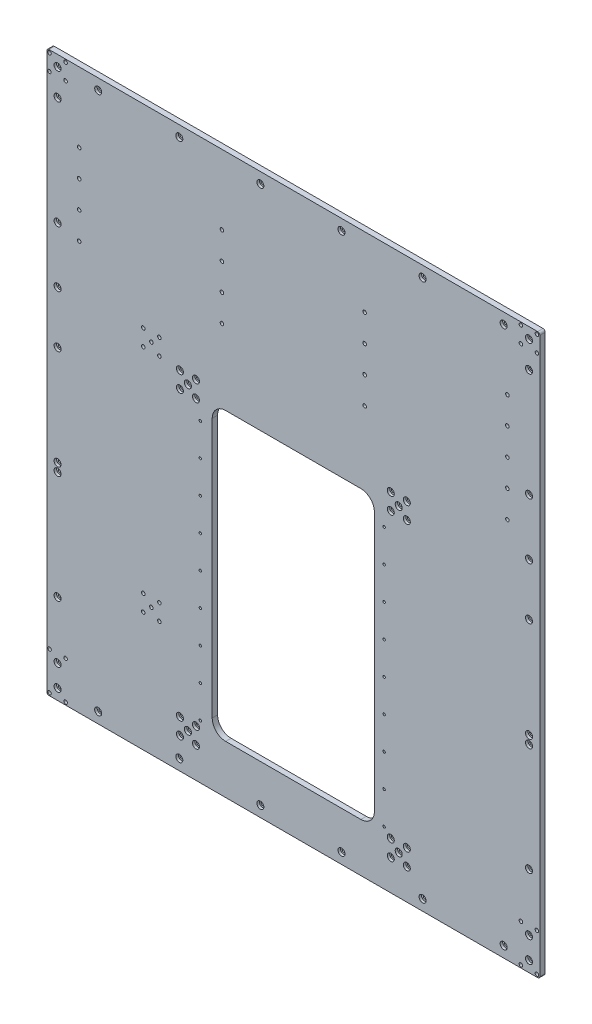
from build123d import *

# Parameters (mm, degrees)
BOSS_EXTRU_1_DEPTH                           = 10
ENL_V_MAT_EXTRU_1_DEPTH                      = 690.813199352
D_GAGEMENT_M63_D                             = 6.6
R_P_TITION_LIN_AIRE5_COUNT                   = 2
R_P_TITION_LIN_AIRE5_PITCH                   = 390
R_P_TITION_LIN_AIRE5_COUNT_DIR2              = 2
R_P_TITION_LIN_AIRE5_PITCH_DIR2              = 555
CHAMBRAGE_POUR_VIS_T_TE_RONDE_BOMB_2_COUNT   = 2
CHAMBRAGE_POUR_VIS_T_TE_RONDE_BOMB_2_PITCH   = 21.009003944
CHAMBRAGE_POUR_VIS_T_TE_RONDE_BOMB_3_COUNT   = 2
CHAMBRAGE_POUR_VIS_T_TE_RONDE_BOMB_3_PITCH   = 21.131226097
CHAMBRAGE_POUR_VIS_T_TE_RONDE_BOMB_4_COUNT   = 2
CHAMBRAGE_POUR_VIS_T_TE_RONDE_BOMB_4_PITCH   = 21.298652181
CHAMBRAGE_POUR_VIS_T_TE_RONDE_BOMB_5_COUNT   = 2
CHAMBRAGE_POUR_VIS_T_TE_RONDE_BOMB_5_PITCH   = 21.177396325
R_P_TITION_LIN_AIRE6_COUNT                   = 2
R_P_TITION_LIN_AIRE6_PITCH                   = 390
R_P_TITION_LIN_AIRE6_COUNT_DIR2              = 2
R_P_TITION_LIN_AIRE6_PITCH_DIR2              = 555
D_GAGEMENT_M64_D                             = 6.6
CHAMBRAGE_POUR_VIS_T_TE_RONDE_BOMB_6_A_COUNT = 2
CHAMBRAGE_POUR_VIS_T_TE_RONDE_BOMB_6_A_PITCH = 29.81471185
CHAMBRAGE_POUR_VIS_T_TE_RONDE_BOMB_7_COUNT   = 2
CHAMBRAGE_POUR_VIS_T_TE_RONDE_BOMB_7_PITCH   = 21.093697317
CHAMBRAGE_POUR_VIS_T_TE_RONDE_BOMB_8_COUNT   = 2
CHAMBRAGE_POUR_VIS_T_TE_RONDE_BOMB_8_PITCH   = 42.330145982
CHAMBRAGE_POUR_VIS_T_TE_RONDE_BOMB_9_COUNT   = 2
CHAMBRAGE_POUR_VIS_T_TE_RONDE_BOMB_9_PITCH   = 30.048697412
R_P_TITION_LIN_AIRE7_COUNT                   = 2
R_P_TITION_LIN_AIRE7_PITCH                   = 425
D_GAGEMENT_M41_D                             = 4.5
R_P_TITION_LIN_AIRE8_COUNT                   = 9
R_P_TITION_LIN_AIRE8_PITCH                   = 60
R_P_TITION_LIN_AIRE8_COUNT_DIR2              = 2
R_P_TITION_LIN_AIRE8_PITCH_DIR2              = 340
D_GAGEMENT_M65_D                             = 6.6
R_P_TITION_LIN_AIRE9_COUNT                   = 2
R_P_TITION_LIN_AIRE9_PITCH                   = 872
R_P_TITION_LIN_AIRE10_COUNT                  = 6
R_P_TITION_LIN_AIRE10_PITCH                  = 150
R_P_TITION_LIN_AIRE11_COUNT                  = 5
R_P_TITION_LIN_AIRE11_PITCH                  = 200
R_P_TITION_LIN_AIRE11_COUNT_DIR2             = 2
R_P_TITION_LIN_AIRE11_PITCH_DIR2             = 872
CHAMBRAGE_POUR_VIS_T_TE_RONDE_BOMB_14_COUNT  = 2
CHAMBRAGE_POUR_VIS_T_TE_RONDE_BOMB_14_PITCH  = 40
R_P_TITION_LIN_AIRE13_COUNT                  = 2
R_P_TITION_LIN_AIRE13_PITCH                  = 872
R_P_TITION_LIN_AIRE14_COUNT                  = 6
R_P_TITION_LIN_AIRE14_PITCH                  = 150
D_GAGEMENT_M66_D                             = 6.6
ESQUISSE41_R                                 = 1.5
ENL_V_MAT_EXTRU_2_DEPTH                      = 690.813199352
CHAMBRAGE_POUR_VIS_T_TE_RONDE_BOMB_17_COUNT  = 2
CHAMBRAGE_POUR_VIS_T_TE_RONDE_BOMB_17_PITCH  = 281
CHAMBRAGE_POUR_VIS_T_TE_RONDE_BOMB_18_COUNT  = 2
CHAMBRAGE_POUR_VIS_T_TE_RONDE_BOMB_18_PITCH  = 916.15773751
CHAMBRAGE_POUR_VIS_T_TE_RONDE_BOMB_19_COUNT  = 2
CHAMBRAGE_POUR_VIS_T_TE_RONDE_BOMB_19_PITCH  = 872
D_GAGEMENT_M67_D                             = 6.6
R_P_TITION_LIN_AIRE15_COUNT                  = 4
R_P_TITION_LIN_AIRE15_PITCH                  = 264
R_P_TITION_LIN_AIRE15_COUNT_DIR2             = 5
R_P_TITION_LIN_AIRE15_PITCH_DIR2             = 50


with BuildPart() as part:
    # Esquisse1 → Boss.-Extru.1 (new body)
    with BuildSketch(Plane.XY):
        with BuildLine():
            Line((-452, -517.5), (452, -517.5))
            ThreePointArc((452, -517.5), (454.828427125, -516.328427125), (456, -513.5))
            Line((456, -513.5), (456, 513.5))
            ThreePointArc((456, 513.5), (454.828427125, 516.328427125), (452, 517.5))
            Line((452, 517.5), (-452, 517.5))
            ThreePointArc((-452, 517.5), (-454.828427125, 516.328427125), (-456, 513.5))
            Line((-456, 513.5), (-456, -513.5))
            ThreePointArc((-456, -513.5), (-454.828427125, -516.328427125), (-452, -517.5))
        make_face()
    extrude(amount=BOSS_EXTRU_1_DEPTH)

    # Esquisse2 → Enlèv. mat.-Extru.1 (cut, through all)
    with BuildSketch(Plane.XY.offset(10)):
        with BuildLine():
            Line((-125, -427.5), (125, -427.5))
            ThreePointArc((125, -427.5), (142.67766953, -420.17766953), (150, -402.5))
            Line((150, -402.5), (150, 77.5))
            ThreePointArc((150, 77.5), (142.67766953, 95.17766953), (125, 102.5))
            Line((125, 102.5), (-125, 102.5))
            ThreePointArc((-125, 102.5), (-142.67766953, 95.17766953), (-150, 77.5))
            Line((-150, 77.5), (-150, -402.5))
            ThreePointArc((-150, -402.5), (-142.67766953, -420.17766953), (-125, -427.5))
        make_face()
    extrude(amount=-ENL_V_MAT_EXTRU_1_DEPTH, mode=Mode.SUBTRACT)

    # Dégagement M63 (through all)
    with Locations(Plane(origin=(0, 0, 0), x_dir=(-1, 0, 0), z_dir=(0, 0, -1))):
        with Locations((-195, 109.5), (-209.949318215, 94.5), (-209.949318215, 124.670710913), (-180.290198957, 124.670710913), (-180.290198957, 94.5)):
            d_gagement_m63 = Hole(D_GAGEMENT_M63_D / 2)

    # Répétition linéaire5: D_gagement M63 2 × 2
    with Locations(*[(-i * R_P_TITION_LIN_AIRE5_PITCH, -j * R_P_TITION_LIN_AIRE5_PITCH_DIR2, 0) for i in range(R_P_TITION_LIN_AIRE5_COUNT) for j in range(R_P_TITION_LIN_AIRE5_COUNT_DIR2) if (i, j) != (0, 0)]):
        add(d_gagement_m63, mode=Mode.SUBTRACT)

    # Esquisse17 → Chambrage pour vis _ t_te ronde bomb_e M (revolve, cut)
    with BuildSketch(Plane(origin=(-195, 109.5, 10), x_dir=(0, -1, 0), z_dir=(1, 0, 0))):
        Polygon((0, 0), (0, 10), (3.3, 10), (3.3, 4.625), (3.325, 4.6), (6.5, 4.6), (6.5, 0), align=None)
    chambrage_pour_vis_t_te_ronde_bomb_e_m = revolve(axis=Axis((-195, 109.5, 16.35), (0, 0, -1)), mode=Mode.SUBTRACT)

    # Chambrage pour vis _ t_te ronde bomb 2: Chambrage pour vis _ t_te ronde bomb_e M ×2
    with Locations(*[Vector(-0.7001665134724497, -0.7139795889322286, 0) * (i * CHAMBRAGE_POUR_VIS_T_TE_RONDE_BOMB_2_PITCH) for i in range(1, CHAMBRAGE_POUR_VIS_T_TE_RONDE_BOMB_2_COUNT)]):
        add(chambrage_pour_vis_t_te_ronde_bomb_e_m, mode=Mode.SUBTRACT)

    # Chambrage pour vis _ t_te ronde bomb 3: Chambrage pour vis _ t_te ronde bomb_e M ×2
    with Locations(*[Vector(-0.6961167788321365, 0.7179285690292387, 0) * (i * CHAMBRAGE_POUR_VIS_T_TE_RONDE_BOMB_3_PITCH) for i in range(1, CHAMBRAGE_POUR_VIS_T_TE_RONDE_BOMB_3_COUNT)]):
        add(chambrage_pour_vis_t_te_ronde_bomb_e_m, mode=Mode.SUBTRACT)

    # Chambrage pour vis _ t_te ronde bomb 4: Chambrage pour vis _ t_te ronde bomb_e M ×2
    with Locations(*[Vector(0.7018903397460314, 0.7122850208808275, 0) * (i * CHAMBRAGE_POUR_VIS_T_TE_RONDE_BOMB_4_PITCH) for i in range(1, CHAMBRAGE_POUR_VIS_T_TE_RONDE_BOMB_4_COUNT)]):
        add(chambrage_pour_vis_t_te_ronde_bomb_e_m, mode=Mode.SUBTRACT)

    # Chambrage pour vis _ t_te ronde bomb 5: Chambrage pour vis _ t_te ronde bomb_e M ×2
    with Locations(*[Vector(0.7059091677743664, -0.708302369650209, 0) * (i * CHAMBRAGE_POUR_VIS_T_TE_RONDE_BOMB_5_PITCH) for i in range(1, CHAMBRAGE_POUR_VIS_T_TE_RONDE_BOMB_5_COUNT)]):
        add(chambrage_pour_vis_t_te_ronde_bomb_e_m, mode=Mode.SUBTRACT)

    # Répétition linéaire6: Chambrage pour vis _ t_te ronde bomb_e M 2 × 2
    with Locations(*[(i * R_P_TITION_LIN_AIRE6_PITCH, -j * R_P_TITION_LIN_AIRE6_PITCH_DIR2, 0) for i in range(R_P_TITION_LIN_AIRE6_COUNT) for j in range(R_P_TITION_LIN_AIRE6_COUNT_DIR2) if (i, j) != (0, 0)]):
        add(chambrage_pour_vis_t_te_ronde_bomb_e_m, mode=Mode.SUBTRACT)

    # Répétition linéaire6 copy 1 sketch → Répétition linéaire6 copy 1 (revolve, cut)
    with BuildSketch(Plane(origin=(-209.709801043, -460.5, 10), x_dir=(0, -1, 0), z_dir=(1, 0, 0))):
        Polygon((0, 0), (0, 10), (3.3, 10), (3.3, 4.625), (3.325, 4.6), (6.5, 4.6), (6.5, 0), align=None)
    revolve(axis=Axis((-209.709801043, -460.5, 16.35), (0, 0, -1)), mode=Mode.SUBTRACT)

    # Répétition linéaire6 copy 2 sketch → Répétition linéaire6 copy 2 (revolve, cut)
    with BuildSketch(Plane(origin=(180.290198957, 94.5, 10), x_dir=(0, -1, 0), z_dir=(1, 0, 0))):
        Polygon((0, 0), (0, 10), (3.3, 10), (3.3, 4.625), (3.325, 4.6), (6.5, 4.6), (6.5, 0), align=None)
    revolve(axis=Axis((180.290198957, 94.5, 16.35), (0, 0, -1)), mode=Mode.SUBTRACT)

    # Répétition linéaire6 copy 3 sketch → Répétition linéaire6 copy 3 (revolve, cut)
    with BuildSketch(Plane(origin=(180.290198957, -460.5, 10), x_dir=(0, -1, 0), z_dir=(1, 0, 0))):
        Polygon((0, 0), (0, 10), (3.3, 10), (3.3, 4.625), (3.325, 4.6), (6.5, 4.6), (6.5, 0), align=None)
    revolve(axis=Axis((180.290198957, -460.5, 16.35), (0, 0, -1)), mode=Mode.SUBTRACT)

    # Répétition linéaire6 copy 4 sketch → Répétition linéaire6 copy 4 (revolve, cut)
    with BuildSketch(Plane(origin=(-209.709801043, -430.329289087, 10), x_dir=(0, -1, 0), z_dir=(1, 0, 0))):
        Polygon((0, 0), (0, 10), (3.3, 10), (3.3, 4.625), (3.325, 4.6), (6.5, 4.6), (6.5, 0), align=None)
    revolve(axis=Axis((-209.709801043, -430.329289087, 16.35), (0, 0, -1)), mode=Mode.SUBTRACT)

    # Répétition linéaire6 copy 5 sketch → Répétition linéaire6 copy 5 (revolve, cut)
    with BuildSketch(Plane(origin=(180.290198957, 124.670710913, 10), x_dir=(0, -1, 0), z_dir=(1, 0, 0))):
        Polygon((0, 0), (0, 10), (3.3, 10), (3.3, 4.625), (3.325, 4.6), (6.5, 4.6), (6.5, 0), align=None)
    revolve(axis=Axis((180.290198957, 124.670710913, 16.35), (0, 0, -1)), mode=Mode.SUBTRACT)

    # Répétition linéaire6 copy 6 sketch → Répétition linéaire6 copy 6 (revolve, cut)
    with BuildSketch(Plane(origin=(180.290198957, -430.329289087, 10), x_dir=(0, -1, 0), z_dir=(1, 0, 0))):
        Polygon((0, 0), (0, 10), (3.3, 10), (3.3, 4.625), (3.325, 4.6), (6.5, 4.6), (6.5, 0), align=None)
    revolve(axis=Axis((180.290198957, -430.329289087, 16.35), (0, 0, -1)), mode=Mode.SUBTRACT)

    # Répétition linéaire6 copy 7 sketch → Répétition linéaire6 copy 7 (revolve, cut)
    with BuildSketch(Plane(origin=(-180.050681785, -430.329289087, 10), x_dir=(0, -1, 0), z_dir=(1, 0, 0))):
        Polygon((0, 0), (0, 10), (3.3, 10), (3.3, 4.625), (3.325, 4.6), (6.5, 4.6), (6.5, 0), align=None)
    revolve(axis=Axis((-180.050681785, -430.329289087, 16.35), (0, 0, -1)), mode=Mode.SUBTRACT)

    # Répétition linéaire6 copy 8 sketch → Répétition linéaire6 copy 8 (revolve, cut)
    with BuildSketch(Plane(origin=(209.949318215, 124.670710913, 10), x_dir=(0, -1, 0), z_dir=(1, 0, 0))):
        Polygon((0, 0), (0, 10), (3.3, 10), (3.3, 4.625), (3.325, 4.6), (6.5, 4.6), (6.5, 0), align=None)
    revolve(axis=Axis((209.949318215, 124.670710913, 16.35), (0, 0, -1)), mode=Mode.SUBTRACT)

    # Répétition linéaire6 copy 9 sketch → Répétition linéaire6 copy 9 (revolve, cut)
    with BuildSketch(Plane(origin=(209.949318215, -430.329289087, 10), x_dir=(0, -1, 0), z_dir=(1, 0, 0))):
        Polygon((0, 0), (0, 10), (3.3, 10), (3.3, 4.625), (3.325, 4.6), (6.5, 4.6), (6.5, 0), align=None)
    revolve(axis=Axis((209.949318215, -430.329289087, 16.35), (0, 0, -1)), mode=Mode.SUBTRACT)

    # Répétition linéaire6 copy 10 sketch → Répétition linéaire6 copy 10 (revolve, cut)
    with BuildSketch(Plane(origin=(-180.050681785, -460.5, 10), x_dir=(0, -1, 0), z_dir=(1, 0, 0))):
        Polygon((0, 0), (0, 10), (3.3, 10), (3.3, 4.625), (3.325, 4.6), (6.5, 4.6), (6.5, 0), align=None)
    revolve(axis=Axis((-180.050681785, -460.5, 16.35), (0, 0, -1)), mode=Mode.SUBTRACT)

    # Répétition linéaire6 copy 11 sketch → Répétition linéaire6 copy 11 (revolve, cut)
    with BuildSketch(Plane(origin=(209.949318215, 94.5, 10), x_dir=(0, -1, 0), z_dir=(1, 0, 0))):
        Polygon((0, 0), (0, 10), (3.3, 10), (3.3, 4.625), (3.325, 4.6), (6.5, 4.6), (6.5, 0), align=None)
    revolve(axis=Axis((209.949318215, 94.5, 16.35), (0, 0, -1)), mode=Mode.SUBTRACT)

    # Répétition linéaire6 copy 12 sketch → Répétition linéaire6 copy 12 (revolve, cut)
    with BuildSketch(Plane(origin=(209.949318215, -460.5, 10), x_dir=(0, -1, 0), z_dir=(1, 0, 0))):
        Polygon((0, 0), (0, 10), (3.3, 10), (3.3, 4.625), (3.325, 4.6), (6.5, 4.6), (6.5, 0), align=None)
    revolve(axis=Axis((209.949318215, -460.5, 16.35), (0, 0, -1)), mode=Mode.SUBTRACT)

    # Dégagement M64 (through all)
    with Locations(Plane.XY.offset(10)):
        with Locations((-277.5, 158.515604526), (-247.68528815, 158.515604526), (-247.68528815, 128.466907114), (-277.5, 128.466907114), (-262.5, 143.5)):
            Hole(D_GAGEMENT_M64_D / 2)

    # Esquisse21 → Chambrage pour vis _ t_te ronde bomb 6 (revolve, cut)
    with BuildSketch(Plane(origin=(-247.68528815, 158.515604526, 0), x_dir=(0, 1, 0), z_dir=(1, 0, 0))):
        Polygon((0, 0), (0, 10), (3.3, 10), (3.3, 4.625), (3.325, 4.6), (6.5, 4.6), (6.5, 0), align=None)
    chambrage_pour_vis_t_te_ronde_bomb_6 = revolve(axis=Axis((-247.68528815, 158.515604526, -6.35), (0, 0, 1)), mode=Mode.SUBTRACT)

    # Chambrage pour vis _ t_te ronde bomb 6 a: Chambrage pour vis _ t_te ronde bomb 6 ×2
    with Locations(*[(-i * CHAMBRAGE_POUR_VIS_T_TE_RONDE_BOMB_6_A_PITCH, 0, 0) for i in range(1, CHAMBRAGE_POUR_VIS_T_TE_RONDE_BOMB_6_A_COUNT)]):
        add(chambrage_pour_vis_t_te_ronde_bomb_6, mode=Mode.SUBTRACT)

    # Chambrage pour vis _ t_te ronde bomb 7: Chambrage pour vis _ t_te ronde bomb 6 ×2
    with Locations(*[Vector(-0.7023288344180294, -0.7118526591542749, 0) * (i * CHAMBRAGE_POUR_VIS_T_TE_RONDE_BOMB_7_PITCH) for i in range(1, CHAMBRAGE_POUR_VIS_T_TE_RONDE_BOMB_7_COUNT)]):
        add(chambrage_pour_vis_t_te_ronde_bomb_6, mode=Mode.SUBTRACT)

    # Chambrage pour vis _ t_te ronde bomb 8: Chambrage pour vis _ t_te ronde bomb 6 ×2
    with Locations(*[Vector(-0.7043375627044492, -0.7098651968955486, 0) * (i * CHAMBRAGE_POUR_VIS_T_TE_RONDE_BOMB_8_PITCH) for i in range(1, CHAMBRAGE_POUR_VIS_T_TE_RONDE_BOMB_8_COUNT)]):
        add(chambrage_pour_vis_t_te_ronde_bomb_6, mode=Mode.SUBTRACT)

    # Chambrage pour vis _ t_te ronde bomb 9: Chambrage pour vis _ t_te ronde bomb 6 ×2
    with Locations(*[(0, -i * CHAMBRAGE_POUR_VIS_T_TE_RONDE_BOMB_9_PITCH, 0) for i in range(1, CHAMBRAGE_POUR_VIS_T_TE_RONDE_BOMB_9_COUNT)]):
        add(chambrage_pour_vis_t_te_ronde_bomb_6, mode=Mode.SUBTRACT)

    # Répétition linéaire7: Chambrage pour vis _ t_te ronde bomb 6 ×2
    with Locations(*[(0, -i * R_P_TITION_LIN_AIRE7_PITCH, 0) for i in range(1, R_P_TITION_LIN_AIRE7_COUNT)]):
        add(chambrage_pour_vis_t_te_ronde_bomb_6, mode=Mode.SUBTRACT)

    # Répétition linéaire7 copy 1 sketch → Répétition linéaire7 copy 1 (revolve, cut)
    with BuildSketch(Plane(origin=(-277.5, -266.484395474, 0), x_dir=(0, 1, 0), z_dir=(1, 0, 0))):
        Polygon((0, 0), (0, 10), (3.3, 10), (3.3, 4.625), (3.325, 4.6), (6.5, 4.6), (6.5, 0), align=None)
    revolve(axis=Axis((-277.5, -266.484395474, -6.35), (0, 0, 1)), mode=Mode.SUBTRACT)

    # Répétition linéaire7 copy 2 sketch → Répétition linéaire7 copy 2 (revolve, cut)
    with BuildSketch(Plane(origin=(-262.5, -281.5, 0), x_dir=(0, 1, 0), z_dir=(1, 0, 0))):
        Polygon((0, 0), (0, 10), (3.3, 10), (3.3, 4.625), (3.325, 4.6), (6.5, 4.6), (6.5, 0), align=None)
    revolve(axis=Axis((-262.5, -281.5, -6.35), (0, 0, 1)), mode=Mode.SUBTRACT)

    # Répétition linéaire7 copy 3 sketch → Répétition linéaire7 copy 3 (revolve, cut)
    with BuildSketch(Plane(origin=(-277.5, -296.533092886, 0), x_dir=(0, 1, 0), z_dir=(1, 0, 0))):
        Polygon((0, 0), (0, 10), (3.3, 10), (3.3, 4.625), (3.325, 4.6), (6.5, 4.6), (6.5, 0), align=None)
    revolve(axis=Axis((-277.5, -296.533092886, -6.35), (0, 0, 1)), mode=Mode.SUBTRACT)

    # Répétition linéaire7 copy 4 sketch → Répétition linéaire7 copy 4 (revolve, cut)
    with BuildSketch(Plane(origin=(-247.68528815, -296.533092886, 0), x_dir=(0, 1, 0), z_dir=(1, 0, 0))):
        Polygon((0, 0), (0, 10), (3.3, 10), (3.3, 4.625), (3.325, 4.6), (6.5, 4.6), (6.5, 0), align=None)
    revolve(axis=Axis((-247.68528815, -296.533092886, -6.35), (0, 0, 1)), mode=Mode.SUBTRACT)

    # Dégagement M41 (through all)
    with Locations(Plane.XY.offset(10)):
        with Locations((-172, -417.5)):
            d_gagement_m41 = Hole(D_GAGEMENT_M41_D / 2)

    # Répétition linéaire8: D_gagement M41 9 × 2
    with Locations(*[(j * R_P_TITION_LIN_AIRE8_PITCH_DIR2, i * R_P_TITION_LIN_AIRE8_PITCH, 0) for i in range(R_P_TITION_LIN_AIRE8_COUNT) for j in range(R_P_TITION_LIN_AIRE8_COUNT_DIR2) if (i, j) != (0, 0)]):
        add(d_gagement_m41, mode=Mode.SUBTRACT)

    # Dégagement M65 (through all)
    with Locations(Plane(origin=(0, 0, 0), x_dir=(-1, 0, 0), z_dir=(0, 0, -1))):
        with Locations((-436.000000001, 497.5), (-421.000000001, 512.508152755), (-450.633748866, 512.508152755), (-450.633748866, 482.515397158), (-421.000000001, 482.684847754), (-436.000000001, 448.286376646), (-389.123182304, 497.5), (-421.000000001, -442.645203276), (-450.633748866, -442.417266528), (-436.000000001, -457.5), (-436.000000001, -497.5), (-450.633748866, -512.5), (-421.000000001, -512.5), (-389.123182304, -497.5), (421.183518058, -442.600682692), (450.908059857, -442.392818763), (435.999999999, -457.5), (435.999999999, -497.5), (450.908059857, -512.5), (421.183518058, -512.5)):
            Hole(D_GAGEMENT_M65_D / 2)

    # Esquisse27 → Chambrage pour vis _ t_te ronde bomb 10 (revolve, cut)
    with BuildSketch(Plane(origin=(436.000000001, 497.5, 10), x_dir=(0, -1, 0), z_dir=(1, 0, 0))):
        Polygon((0, 0), (0, 10), (3.3, 10), (3.3, 4.625), (3.325, 4.6), (6.5, 4.6), (6.5, 0), align=None)
    chambrage_pour_vis_t_te_ronde_bomb_10 = revolve(axis=Axis((436.000000001, 497.5, 16.35), (0, 0, -1)), mode=Mode.SUBTRACT)

    # Répétition linéaire9: Chambrage pour vis _ t_te ronde bomb 10 ×2
    with Locations(*[(-i * R_P_TITION_LIN_AIRE9_PITCH, 0, 0) for i in range(1, R_P_TITION_LIN_AIRE9_COUNT)]):
        add(chambrage_pour_vis_t_te_ronde_bomb_10, mode=Mode.SUBTRACT)

    # Esquisse29 → Chambrage pour vis _ t_te ronde bomb 11 (revolve, cut)
    with BuildSketch(Plane(origin=(389.123182304, 497.5, 10), x_dir=(0, -1, 0), z_dir=(1, 0, 0))):
        Polygon((0, 0), (0, 10), (3.3, 10), (3.3, 4.625), (3.325, 4.6), (6.5, 4.6), (6.5, 0), align=None)
    chambrage_pour_vis_t_te_ronde_bomb_11 = revolve(axis=Axis((389.123182304, 497.5, 16.35), (0, 0, -1)), mode=Mode.SUBTRACT)

    # Répétition linéaire10: Chambrage pour vis _ t_te ronde bomb 11 ×6
    with Locations(*[(-i * R_P_TITION_LIN_AIRE10_PITCH, 0, 0) for i in range(1, R_P_TITION_LIN_AIRE10_COUNT)]):
        add(chambrage_pour_vis_t_te_ronde_bomb_11, mode=Mode.SUBTRACT)

    # Esquisse31 → Chambrage pour vis _ t_te ronde bomb 12 (revolve, cut)
    with BuildSketch(Plane(origin=(436.000000001, 448.286376646, 10), x_dir=(0, -1, 0), z_dir=(1, 0, 0))):
        Polygon((0, 0), (0, 10), (3.3, 10), (3.3, 4.625), (3.325, 4.6), (6.5, 4.6), (6.5, 0), align=None)
    chambrage_pour_vis_t_te_ronde_bomb_12 = revolve(axis=Axis((436.000000001, 448.286376646, 16.35), (0, 0, -1)), mode=Mode.SUBTRACT)

    # Répétition linéaire11: Chambrage pour vis _ t_te ronde bomb 12 5 × 2
    with Locations(*[(-j * R_P_TITION_LIN_AIRE11_PITCH_DIR2, -i * R_P_TITION_LIN_AIRE11_PITCH, 0) for i in range(R_P_TITION_LIN_AIRE11_COUNT) for j in range(R_P_TITION_LIN_AIRE11_COUNT_DIR2) if (i, j) != (0, 0)]):
        add(chambrage_pour_vis_t_te_ronde_bomb_12, mode=Mode.SUBTRACT)

    # Esquisse33 → Chambrage pour vis _ t_te ronde bomb 13 (revolve, cut)
    with BuildSketch(Plane(origin=(436.000000001, -457.5, 10), x_dir=(0, -1, 0), z_dir=(1, 0, 0))):
        Polygon((0, 0), (0, 10), (3.3, 10), (3.3, 4.625), (3.325, 4.6), (6.5, 4.6), (6.5, 0), align=None)
    chambrage_pour_vis_t_te_ronde_bomb_13 = revolve(axis=Axis((436.000000001, -457.5, 16.35), (0, 0, -1)), mode=Mode.SUBTRACT)

    # Chambrage pour vis _ t_te ronde bomb 14: Chambrage pour vis _ t_te ronde bomb 13 ×2
    with Locations(*[(0, -i * CHAMBRAGE_POUR_VIS_T_TE_RONDE_BOMB_14_PITCH, 0) for i in range(1, CHAMBRAGE_POUR_VIS_T_TE_RONDE_BOMB_14_COUNT)]):
        add(chambrage_pour_vis_t_te_ronde_bomb_13, mode=Mode.SUBTRACT)

    # Répétition linéaire13: Chambrage pour vis _ t_te ronde bomb 13 ×2
    with Locations(*[(-i * R_P_TITION_LIN_AIRE13_PITCH, 0, 0) for i in range(1, R_P_TITION_LIN_AIRE13_COUNT)]):
        add(chambrage_pour_vis_t_te_ronde_bomb_13, mode=Mode.SUBTRACT)

    # Répétition linéaire13 copy 1 sketch → Répétition linéaire13 copy 1 (revolve, cut)
    with BuildSketch(Plane(origin=(-435.999999999, -497.5, 10), x_dir=(0, -1, 0), z_dir=(1, 0, 0))):
        Polygon((0, 0), (0, 10), (3.3, 10), (3.3, 4.625), (3.325, 4.6), (6.5, 4.6), (6.5, 0), align=None)
    revolve(axis=Axis((-435.999999999, -497.5, 16.35), (0, 0, -1)), mode=Mode.SUBTRACT)

    # Esquisse35 → Chambrage pour vis _ t_te ronde bomb 15 (revolve, cut)
    with BuildSketch(Plane(origin=(389.123182304, -497.5, 10), x_dir=(0, -1, 0), z_dir=(1, 0, 0))):
        Polygon((0, 0), (0, 10), (3.3, 10), (3.3, 4.625), (3.325, 4.6), (6.5, 4.6), (6.5, 0), align=None)
    chambrage_pour_vis_t_te_ronde_bomb_15 = revolve(axis=Axis((389.123182304, -497.5, 16.35), (0, 0, -1)), mode=Mode.SUBTRACT)

    # Répétition linéaire14: Chambrage pour vis _ t_te ronde bomb 15 ×6
    with Locations(*[(-i * R_P_TITION_LIN_AIRE14_PITCH, 0, 0) for i in range(1, R_P_TITION_LIN_AIRE14_COUNT)]):
        add(chambrage_pour_vis_t_te_ronde_bomb_15, mode=Mode.SUBTRACT)

    # Dégagement M66 (through all)
    with Locations(Plane(origin=(0, 0, 0), x_dir=(-1, 0, 0), z_dir=(0, 0, -1))):
        with Locations((421.185682092, 512.436649225), (450.992654505, 512.436649225), (450.992654505, 482.629676813), (421.185682092, 482.629676813)):
            Hole(D_GAGEMENT_M66_D / 2)

    # Esquisse41 → Enlèv. mat.-Extru.2 (cut, through all)
    with BuildSketch(Plane.XY.offset(10)):
        with Locations((-436, 144.5)):
            Circle(ESQUISSE41_R)
        with Locations((-436, -136.5)):
            Circle(ESQUISSE41_R)
    enl_v_mat_extru_2 = extrude(amount=-ENL_V_MAT_EXTRU_2_DEPTH, mode=Mode.SUBTRACT)

    # Symétrie1: Enlèv. mat.-Extru.2 across plane
    add(enl_v_mat_extru_2.mirror(Plane(origin=(0, 0, 0), x_dir=(0, 0, 1), z_dir=(1, 0, 0))), mode=Mode.SUBTRACT)

    # Esquisse44 → Chambrage pour vis _ t_te ronde bomb 16 (revolve, cut)
    with BuildSketch(Plane(origin=(-436, 144.5, 10), x_dir=(0, -1, 0), z_dir=(1, 0, 0))):
        Polygon((0, 0), (0, 10), (3.3, 10), (3.3, 4.625), (3.325, 4.6), (6.5, 4.6), (6.5, 0), align=None)
    chambrage_pour_vis_t_te_ronde_bomb_16 = revolve(axis=Axis((-436, 144.5, 16.35), (0, 0, -1)), mode=Mode.SUBTRACT)

    # Chambrage pour vis _ t_te ronde bomb 17: Chambrage pour vis _ t_te ronde bomb 16 ×2
    with Locations(*[(0, -i * CHAMBRAGE_POUR_VIS_T_TE_RONDE_BOMB_17_PITCH, 0) for i in range(1, CHAMBRAGE_POUR_VIS_T_TE_RONDE_BOMB_17_COUNT)]):
        add(chambrage_pour_vis_t_te_ronde_bomb_16, mode=Mode.SUBTRACT)

    # Chambrage pour vis _ t_te ronde bomb 18: Chambrage pour vis _ t_te ronde bomb 16 ×2
    with Locations(*[Vector(0.9518011629413234, -0.306715741727653, 0) * (i * CHAMBRAGE_POUR_VIS_T_TE_RONDE_BOMB_18_PITCH) for i in range(1, CHAMBRAGE_POUR_VIS_T_TE_RONDE_BOMB_18_COUNT)]):
        add(chambrage_pour_vis_t_te_ronde_bomb_16, mode=Mode.SUBTRACT)

    # Chambrage pour vis _ t_te ronde bomb 19: Chambrage pour vis _ t_te ronde bomb 16 ×2
    with Locations(*[(i * CHAMBRAGE_POUR_VIS_T_TE_RONDE_BOMB_19_PITCH, 0, 0) for i in range(1, CHAMBRAGE_POUR_VIS_T_TE_RONDE_BOMB_19_COUNT)]):
        add(chambrage_pour_vis_t_te_ronde_bomb_16, mode=Mode.SUBTRACT)

    # Dégagement M67 (through all)
    with Locations(Plane(origin=(0, 0, 0), x_dir=(-1, 0, 0), z_dir=(0, 0, -1))):
        with Locations((-396.00143494, 188.397832099)):
            d_gagement_m67 = Hole(D_GAGEMENT_M67_D / 2)

    # Répétition linéaire15: D_gagement M67 4 × 5, 3 skipped
    with Locations(*[(-i * R_P_TITION_LIN_AIRE15_PITCH, j * R_P_TITION_LIN_AIRE15_PITCH_DIR2, 0) for i in range(R_P_TITION_LIN_AIRE15_COUNT) for j in range(R_P_TITION_LIN_AIRE15_COUNT_DIR2) if (i, j) not in ((0, 0), (1, 0), (2, 0), (3, 0))]):
        add(d_gagement_m67, mode=Mode.SUBTRACT)


solid = part.part
